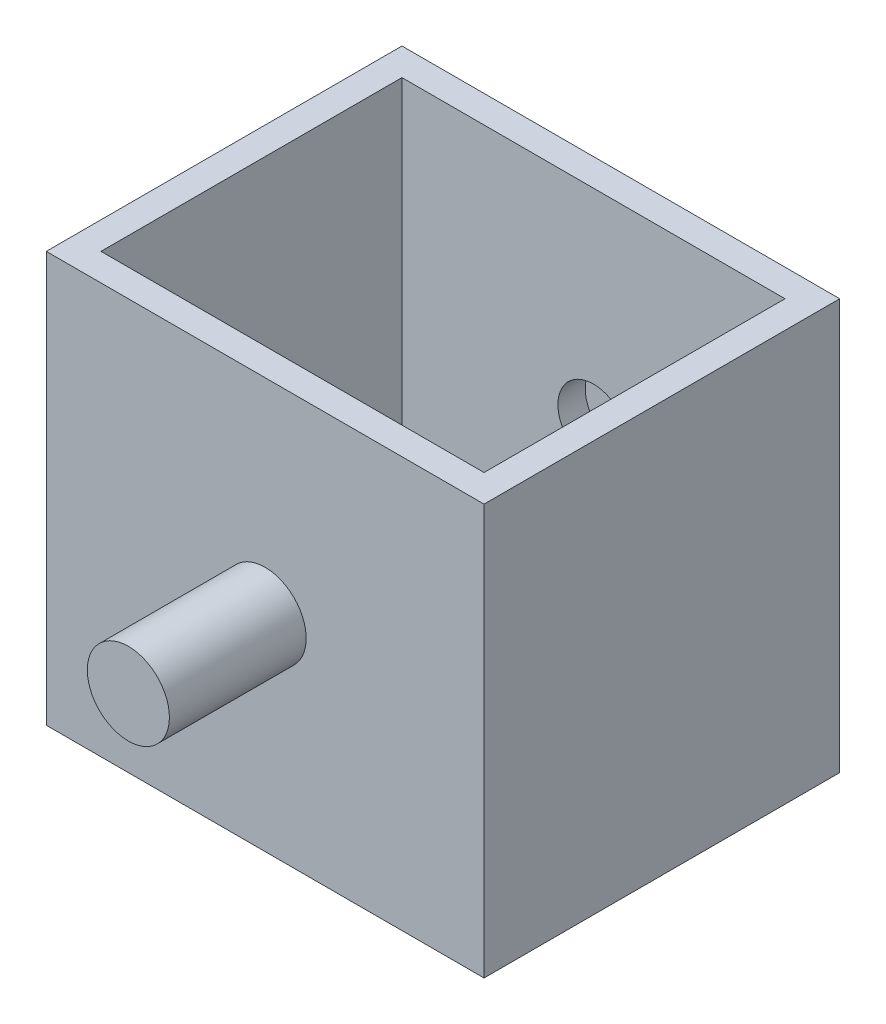
from build123d import *

# Parameters (mm, degrees)
SKETCH1_W               = 40.64
SKETCH1_H               = 38.1
MAIN_BODY_DEPTH         = 33.02
HOLLOW_IT_T             = -2.54
SKETCH3_R               = 3.81
NIBBLE_NO_1_DEPTH       = 12.7
NIBBLE_START            = 12.7
SKETCH4_R               = 3.81
NIBBLE_NO_2_DEPTH       = 12.7
SKETCH5_W               = 1.27
SKETCH5_H               = 3.81
FLAG_DEPTH              = 25.4
NIBBLE_HOLES_DEPTH      = 30.48
NIBBLE_HOLES_DEPTH_BACK = 2.54
SKETCH6_R               = 3.302


with BuildPart() as part:
    # Sketch1 → main body (new body)
    with BuildSketch(Plane.XY):
        Rectangle(SKETCH1_W, SKETCH1_H)
    extrude(amount=MAIN_BODY_DEPTH)

    # hollow it
    hollow_it_openings = [part.faces().sort_by_distance(p)[0] for p in [
        (0, 19.05, 16.51),
    ]]
    offset(amount=HOLLOW_IT_T, openings=hollow_it_openings, kind=Kind.INTERSECTION)

    # Sketch3 → nibble no 1 (add)
    with BuildSketch(Plane.XY.offset(33.02)):
        Circle(SKETCH3_R)
    extrude(amount=NIBBLE_NO_1_DEPTH)

    # Sketch4 → nibble no 2 (add)
    with BuildSketch(Plane(origin=(0, 0, 0), x_dir=(-1, 0, 0), z_dir=(0, 0, -1)).offset(NIBBLE_START)):
        Circle(SKETCH4_R)
    extrude(amount=-NIBBLE_NO_2_DEPTH)

    # Sketch5 → flag (add)
    with BuildSketch(Plane(origin=(0, 0, 0), x_dir=(-1, 0, 0), z_dir=(0, -1, 0))):
        with Locations((-0.18666561, 6.353298227)):
            Rectangle(SKETCH5_W, SKETCH5_H)
    extrude(amount=FLAG_DEPTH)

    # Sketch6 → nibble holes (cut, two sides: drawn at the far end of the back side and taken through both)
    with BuildSketch(Plane.XY.offset(2.54).offset(-NIBBLE_HOLES_DEPTH_BACK)):
        Circle(SKETCH6_R)
    extrude(amount=NIBBLE_HOLES_DEPTH + NIBBLE_HOLES_DEPTH_BACK, mode=Mode.SUBTRACT)


solid = part.part
